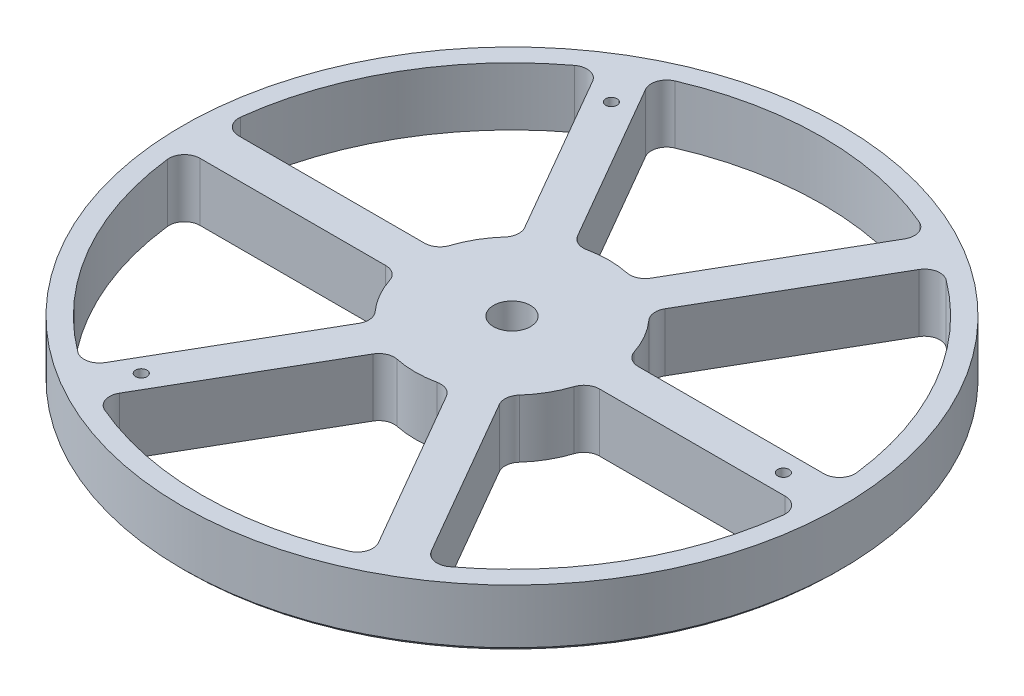
from build123d import *

# Parameters (mm, degrees)
SKETCH2_W                    = 84.99983
SKETCH2_H                    = 15
F_32_0_116_DIAMETER_HOLE1_D  = 2.9464
CIRPATTERN3_COUNT            = 3
CUT_EXTRUDE1_DEPTH           = 122.14017583
FILLET1_R                    = 4
CIRPATTERN4_COUNT            = 6
FILLET1_OF_CIRPATTERN4_R     = 4
CHAMFER2_SIZE                = 1
F_3_8_0_375_DIAMETER_HOLE1_D = 9.525


with BuildPart() as part:
    # Sketch2 → Revolve1 (revolve)
    with BuildSketch(Plane(origin=(0, 0, 0), x_dir=(0, 0, -1), z_dir=(1, 0, 0))):
        with Locations((-42.499915, 7.5)):
            Rectangle(SKETCH2_W, SKETCH2_H)
    revolve(axis=Axis((0, -0.75, 0), (0, 1, 0)))

    # #32 (0.116) Diameter Hole1 (through all)
    with Locations(Plane(origin=(0, 15, 0), x_dir=(1, 0, 0), z_dir=(0, 1, 0))):
        with Locations((-35, 60.621778265)):
            f_32_0_116_diameter_hole1 = Hole(F_32_0_116_DIAMETER_HOLE1_D / 2)

    # CirPattern3: #32 (0.116) Diameter Hole1 ×3 about axis
    cirpattern3_axis = Axis((0, -0.75, 0), (0, 1, 0))
    for i in range(1, CIRPATTERN3_COUNT):
        add(f_32_0_116_diameter_hole1.rotate(cirpattern3_axis, i * 360 / CIRPATTERN3_COUNT), mode=Mode.SUBTRACT)

    # Sketch8 → Cut-Extrude1 (cut, through all)
    with BuildSketch(Plane(origin=(0, 15, 0), x_dir=(1, 0, 0), z_dir=(0, 1, 0))):
        with BuildLine():
            Line((-7.917321695, 23.713203436), (-35.591586371, 71.646435917))
            ThreePointArc((-35.591586371, 71.646435917), (0, 79.99983), (35.591586371, 71.646435917))
            Line((35.591586371, 71.646435917), (7.917321695, 23.713203436))
            ThreePointArc((7.917321695, 23.713203436), (0, 25), (-7.917321695, 23.713203436))
        make_face()
    cut_extrude1 = extrude(amount=-CUT_EXTRUDE1_DEPTH, mode=Mode.SUBTRACT)

    # Fillet1
    fillet1_edges = [part.edges().sort_by_distance(p)[0] for p in [
        (7.917321695, 7.5, -23.713203436),
        (35.591586371, 7.5, -71.646435917),
        (-7.917321695, 7.5, -23.713203436),
        (-35.591586371, 7.5, -71.646435917),
    ]]
    fillet(fillet1_edges, radius=FILLET1_R)

    # CirPattern4: Cut-Extrude1 ×6 about axis
    cirpattern4_axis = Axis((0, -0.75, 0), (0, 1, 0))
    for i in range(1, CIRPATTERN4_COUNT):
        add(cut_extrude1.rotate(cirpattern4_axis, i * 360 / CIRPATTERN4_COUNT), mode=Mode.SUBTRACT)

    # Fillet1 of CirPattern4
    fillet1_of_cirpattern4_edges = [part.edges().sort_by_distance(p)[0] for p in [
        (-16.577575733, 7.5, -18.713203436),
        (-44.251840409, 7.5, -66.646435917),
        (-24.494897428, 7.5, -5),
        (-79.84342678, 7.5, -5),
        (-24.494897428, 7.5, 5),
        (-79.84342678, 7.5, 5),
        (-16.577575733, 7.5, 18.713203436),
        (-44.251840409, 7.5, 66.646435917),
        (-7.917321695, 7.5, 23.713203436),
        (-35.591586371, 7.5, 71.646435917),
        (7.917321695, 7.5, 23.713203436),
        (35.591586371, 7.5, 71.646435917),
        (16.577575733, 7.5, 18.713203436),
        (44.251840409, 7.5, 66.646435917),
        (24.494897428, 7.5, 5),
        (79.84342678, 7.5, 5),
        (24.494897428, 7.5, -5),
        (79.84342678, 7.5, -5),
        (16.577575733, 7.5, -18.713203436),
        (44.251840409, 7.5, -66.646435917),
    ]]
    fillet(fillet1_of_cirpattern4_edges, radius=FILLET1_OF_CIRPATTERN4_R)

    # Chamfer2
    chamfer2_edges = [part.edges().sort_by_distance(p)[0] for p in [
        (0, 0, -84.99983),
    ]]
    chamfer(chamfer2_edges, length=CHAMFER2_SIZE)

    # 3/8 (0.375) Diameter Hole1 (through all)
    with Locations(Plane(origin=(0, 0, 0), x_dir=(-1, 0, 0), z_dir=(0, -1, 0))):
        with Locations((0, 0)):
            Hole(F_3_8_0_375_DIAMETER_HOLE1_D / 2)


solid = part.part
